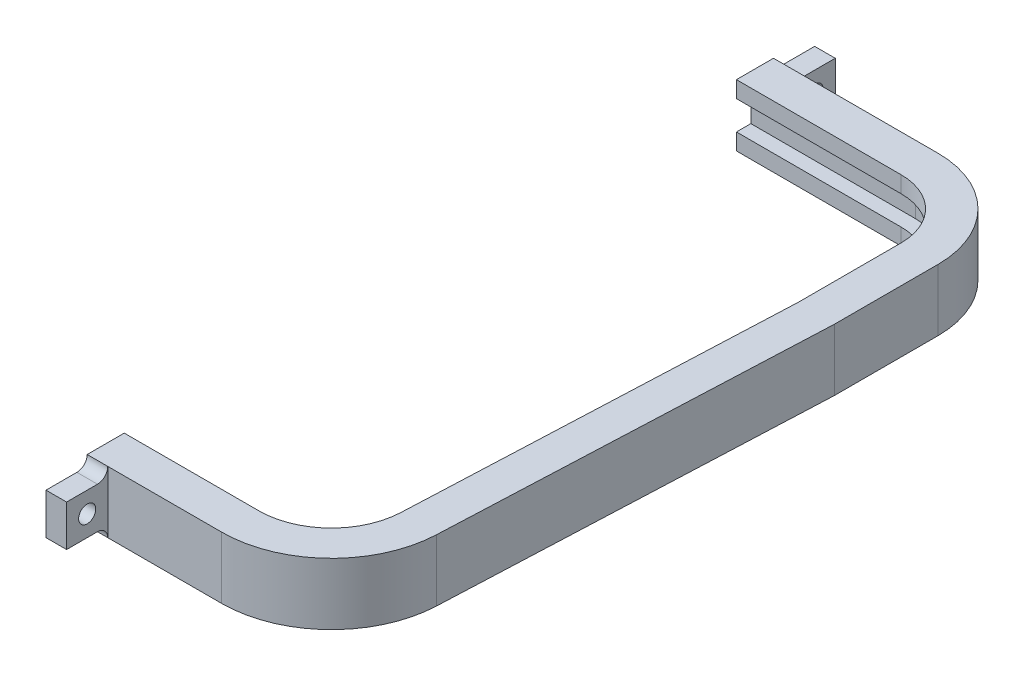
from build123d import *

# Parameters (mm, degrees)
BOSS_EXTRUDE1_DEPTH      = 4.5
BOSS_EXTRUDE1_DEPTH_BACK = 4.5
CUT_EXTRUDE1_DEPTH       = 2.1
CUT_EXTRUDE1_DEPTH_BACK  = 2.1
BOSS_EXTRUDE2_DEPTH      = 3
BOSS_EXTRUDE2_DEPTH_BACK = 3
SKETCH2_W                = 6
SKETCH2_H                = 6
SKETCH2_R                = 1.25
FILLET2_R                = 1.5
SKETCH5_W                = 120
SKETCH5_H                = 30
CUT_EXTRUDE2_DEPTH       = 68.825142831


with BuildPart() as part:
    # Sketch1 → Boss-Extrude1 (new, two sides: drawn at the far end of the back side and taken through both)
    # profile 1 of 2: a face of its own
    with BuildSketch(Plane(origin=(0, 0, 0), x_dir=(1, 0, 0), z_dir=(0, 1, 0)).offset(-BOSS_EXTRUDE1_DEPTH_BACK)):
        with BuildLine():
            Line((-24, 50), (24, 50))
            ThreePointArc((24, 50), (33.899494937, 45.899494937), (38, 36))
            Line((38, 36), (38, 20.869079534))
            Line((38, 20.869079534), (35.573892834, -34.697910198))
            ThreePointArc((35.573892834, -34.697910198), (30.653330181, -45.557823393), (19.589121288, -50))
            Line((19.589121288, -50), (-19.589121288, -50))
            ThreePointArc((-19.589121288, -50), (-30.653330181, -45.557823393), (-35.573892834, -34.697910198))
            Line((-35.573892834, -34.697910198), (-38, 20.869079534))
            Line((-38, 20.869079534), (-38, 36))
            ThreePointArc((-38, 36), (-33.899494937, 45.899494937), (-24, 50))
        make_face()
        with BuildLine():
            ThreePointArc((-24, 46.7), (-31.566042559, 43.566042559), (-34.7, 36))
            Line((-34.7, 36), (-34.7, 20.94108579))
            Line((-34.7, 20.94108579), (-32.277033702, -34.55396622))
            ThreePointArc((-32.277033702, -34.55396622), (-28.371337097, -43.174022318), (-19.589121288, -46.7))
            Line((-19.589121288, -46.7), (19.589121288, -46.7))
            ThreePointArc((19.589121288, -46.7), (28.371337097, -43.174022318), (32.277033702, -34.55396622))
            Line((32.277033702, -34.55396622), (34.7, 20.94108579))
            Line((34.7, 20.94108579), (34.7, 36))
            ThreePointArc((34.7, 36), (31.566042559, 43.566042559), (24, 46.7))
            Line((24, 46.7), (-24, 46.7))
        make_face(mode=Mode.SUBTRACT)
    # profile 2 of 2: a face of its own
    with BuildSketch(Plane(origin=(0, 0, 0), x_dir=(1, 0, 0), z_dir=(0, 1, 0)).offset(-BOSS_EXTRUDE1_DEPTH_BACK)):
        with BuildLine():
            Line((-24, 46.7), (24, 46.7))
            ThreePointArc((24, 46.7), (31.566042559, 43.566042559), (34.7, 36))
            Line((34.7, 36), (34.7, 20.94108579))
            Line((34.7, 20.94108579), (32.277033702, -34.55396622))
            ThreePointArc((32.277033702, -34.55396622), (28.371337097, -43.174022318), (19.589121288, -46.7))
            Line((19.589121288, -46.7), (-19.589121288, -46.7))
            ThreePointArc((-19.589121288, -46.7), (-28.371337097, -43.174022318), (-32.277033702, -34.55396622))
            Line((-32.277033702, -34.55396622), (-34.7, 20.94108579))
            Line((-34.7, 20.94108579), (-34.7, 36))
            ThreePointArc((-34.7, 36), (-31.566042559, 43.566042559), (-24, 46.7))
        make_face()
        with BuildLine():
            ThreePointArc((-24, 44.6), (-30.081118318, 42.081118318), (-32.6, 36))
            Line((-32.6, 36), (-32.6, 20.986907953))
            Line((-32.6, 20.986907953), (-30.179032437, -34.462365506))
            ThreePointArc((-30.179032437, -34.462365506), (-26.91915968, -41.657057998), (-19.589121288, -44.6))
            Line((-19.589121288, -44.6), (19.589121288, -44.6))
            ThreePointArc((19.589121288, -44.6), (26.91915968, -41.657057998), (30.179032437, -34.462365506))
            Line((30.179032437, -34.462365506), (32.6, 20.986907953))
            Line((32.6, 20.986907953), (32.6, 36))
            ThreePointArc((32.6, 36), (30.081118318, 42.081118318), (24, 44.6))
            Line((24, 44.6), (-24, 44.6))
        make_face(mode=Mode.SUBTRACT)
    extrude(amount=BOSS_EXTRUDE1_DEPTH + BOSS_EXTRUDE1_DEPTH_BACK)

    # Sketch1<3> → Cut-Extrude1 (cut, two sides: drawn at the far end of the back side and taken through both)
    with BuildSketch(Plane(origin=(0, 0, 0), x_dir=(1, 0, 0), z_dir=(0, 1, 0)).offset(-CUT_EXTRUDE1_DEPTH_BACK)):
        with BuildLine():
            Line((-24, 46.7), (24, 46.7))
            ThreePointArc((24, 46.7), (31.566042559, 43.566042559), (34.7, 36))
            Line((34.7, 36), (34.7, 20.94108579))
            Line((34.7, 20.94108579), (32.277033702, -34.55396622))
            ThreePointArc((32.277033702, -34.55396622), (28.371337097, -43.174022318), (19.589121288, -46.7))
            Line((19.589121288, -46.7), (-19.589121288, -46.7))
            ThreePointArc((-19.589121288, -46.7), (-28.371337097, -43.174022318), (-32.277033702, -34.55396622))
            Line((-32.277033702, -34.55396622), (-34.7, 20.94108579))
            Line((-34.7, 20.94108579), (-34.7, 36))
            ThreePointArc((-34.7, 36), (-31.566042559, 43.566042559), (-24, 46.7))
        make_face()
        with BuildLine():
            Line((-32, 36), (-32, 21))
            Line((-32, 21), (-29.579603504, -34.436193874))
            ThreePointArc((-29.579603504, -34.436193874), (-26.504251846, -41.223639621), (-19.589121288, -44))
            Line((-19.589121288, -44), (19.589121288, -44))
            ThreePointArc((19.589121288, -44), (26.504251846, -41.223639621), (29.579603504, -34.436193874))
            Line((29.579603504, -34.436193874), (32, 21))
            Line((32, 21), (32, 36))
            ThreePointArc((32, 36), (29.656854249, 41.656854249), (24, 44))
            Line((24, 44), (-24, 44))
            ThreePointArc((-24, 44), (-29.656854249, 41.656854249), (-32, 36))
        make_face(mode=Mode.SUBTRACT)
    extrude(amount=CUT_EXTRUDE1_DEPTH + CUT_EXTRUDE1_DEPTH_BACK, mode=Mode.SUBTRACT)

    # Sketch2 → Boss-Extrude2 (add, two sides: drawn at the far end of the back side and taken through both)
    # profile 1 of 2: a face of its own
    with BuildSketch(Plane(origin=(0, 0, 0), x_dir=(0, 0, -1), z_dir=(1, 0, 0)).offset(-BOSS_EXTRUDE2_DEPTH_BACK)):
        with Locations((-53, 0)):
            Rectangle(SKETCH2_W, SKETCH2_H)
        with Locations((-53, 0)):
            Circle(SKETCH2_R, mode=Mode.SUBTRACT)
    # profile 2 of 2: a face of its own
    with BuildSketch(Plane(origin=(0, 0, 0), x_dir=(0, 0, -1), z_dir=(1, 0, 0)).offset(-BOSS_EXTRUDE2_DEPTH_BACK)):
        with Locations((53, 0)):
            Rectangle(SKETCH2_W, SKETCH2_H)
        with Locations((53, 0)):
            Circle(SKETCH2_R, mode=Mode.SUBTRACT)
    extrude(amount=BOSS_EXTRUDE2_DEPTH + BOSS_EXTRUDE2_DEPTH_BACK)

    # Fillet2
    fillet2_edges = [part.edges().sort_by_distance(p)[0] for p in [
        (0, 3, 50),
        (0, -3, 50),
        (0, -3, -50),
        (0, 3, -50),
    ]]
    fillet(fillet2_edges, radius=FILLET2_R - 0.0001)  # a hair under: the kernel refuses the full size

    # Sketch5 → Cut-Extrude2 (cut, through all)
    with BuildSketch(Plane(origin=(0, 0, 0), x_dir=(0, 0, -1), z_dir=(1, 0, 0))):
        Rectangle(SKETCH5_W, SKETCH5_H)
    extrude(amount=-CUT_EXTRUDE2_DEPTH, mode=Mode.SUBTRACT)


solid = part.part
